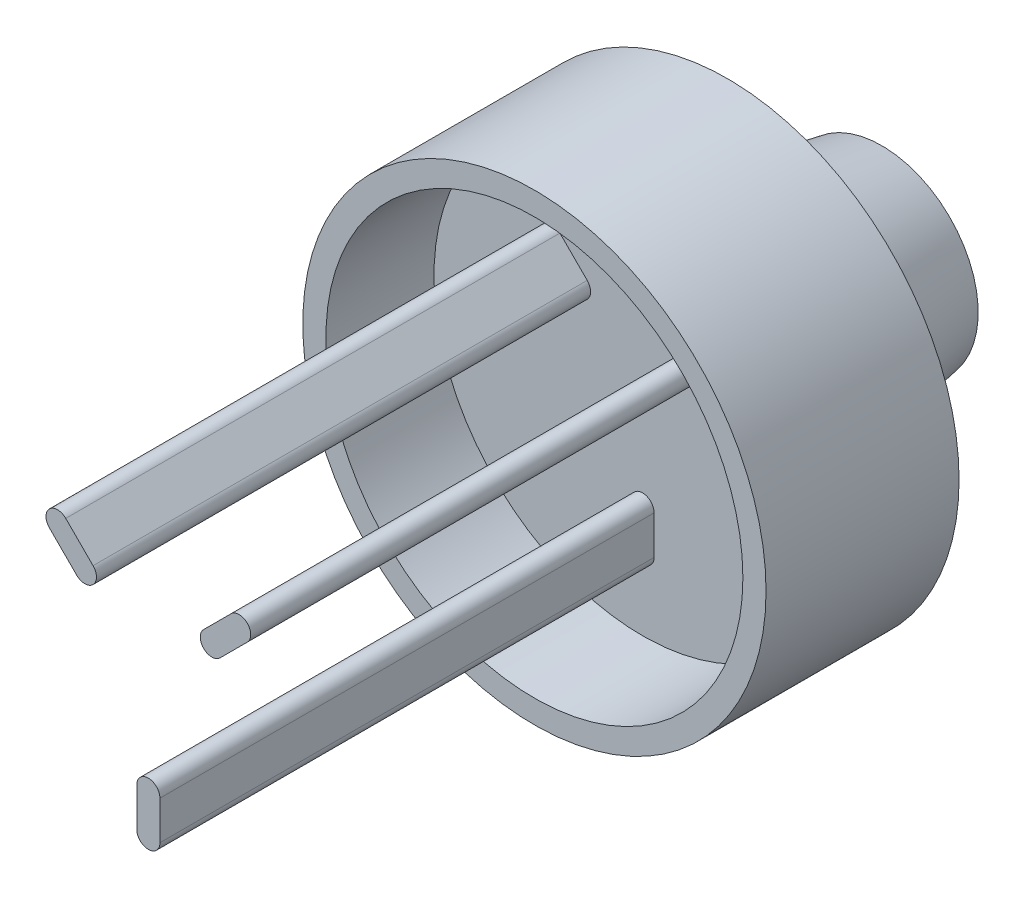
from build123d import *

# Parameters (mm, degrees)
CIRCLE_R            = 7.62
BOSS_EXTRUDE3_DEPTH = 3.175
INNER_CIRCLE_R      = 6.858
CUT_EXTRUDE1_DEPTH  = 3.556
BACK_CIRCLE_R       = 4.064
BOSS_EXTRUDE4_DEPTH = 5.08
BOSS_EXTRUDE4_TAPER = 10
BOSS_EXTRUDE5_DEPTH = 16.256


with BuildPart() as part:
    # Circle → Boss-Extrude3 (new, symmetric)
    with BuildSketch(Plane.XY):
        Circle(CIRCLE_R)
    extrude(amount=BOSS_EXTRUDE3_DEPTH, both=True)

    # Inner Circle → Cut-Extrude1 (cut)
    with BuildSketch(Plane.XY.offset(3.175)):
        Circle(INNER_CIRCLE_R)
    extrude(amount=-CUT_EXTRUDE1_DEPTH, mode=Mode.SUBTRACT)

    # Back Circle → Boss-Extrude4 (add)
    with BuildSketch(Plane(origin=(0, 0, -3.175), x_dir=(-1, 0, 0), z_dir=(0, 0, -1))):
        Circle(BACK_CIRCLE_R)
    extrude(amount=BOSS_EXTRUDE4_DEPTH, taper=BOSS_EXTRUDE4_TAPER)

    # Prongs → Boss-Extrude5 (add)
    with BuildSketch(Plane.XY.offset(-0.381)):
        with BuildLine():
            Line((2.717161655, 3.255977023), (1.819136043, 2.357951411))
            ThreePointArc((1.819136043, 2.357951411), (1.819136043, 1.819136043), (2.357951411, 1.819136043))
            Line((2.357951411, 1.819136043), (3.255977023, 2.717161655))
            ThreePointArc((3.255977023, 2.717161655), (3.255977023, 3.255977023), (2.717161655, 3.255977023))
        make_face()
        with BuildLine():
            Line((-2.717161655, 3.255977023), (-1.819136043, 2.357951411))
            ThreePointArc((-1.819136043, 2.357951411), (-1.819136043, 1.819136043), (-2.357951411, 1.819136043))
            Line((-2.357951411, 1.819136043), (-3.255977023, 2.717161655))
            ThreePointArc((-3.255977023, 2.717161655), (-3.255977023, 3.255977023), (-2.717161655, 3.255977023))
        make_face()
        with BuildLine():
            Line((-0.381, -4.435382437), (-0.381, -3.165382437))
            ThreePointArc((-0.381, -3.165382437), (0, -2.784382437), (0.381, -3.165382437))
            Line((0.381, -3.165382437), (0.381, -4.435382437))
            ThreePointArc((0.381, -4.435382437), (0, -4.816382437), (-0.381, -4.435382437))
        make_face()
    extrude(amount=BOSS_EXTRUDE5_DEPTH)


solid = part.part
